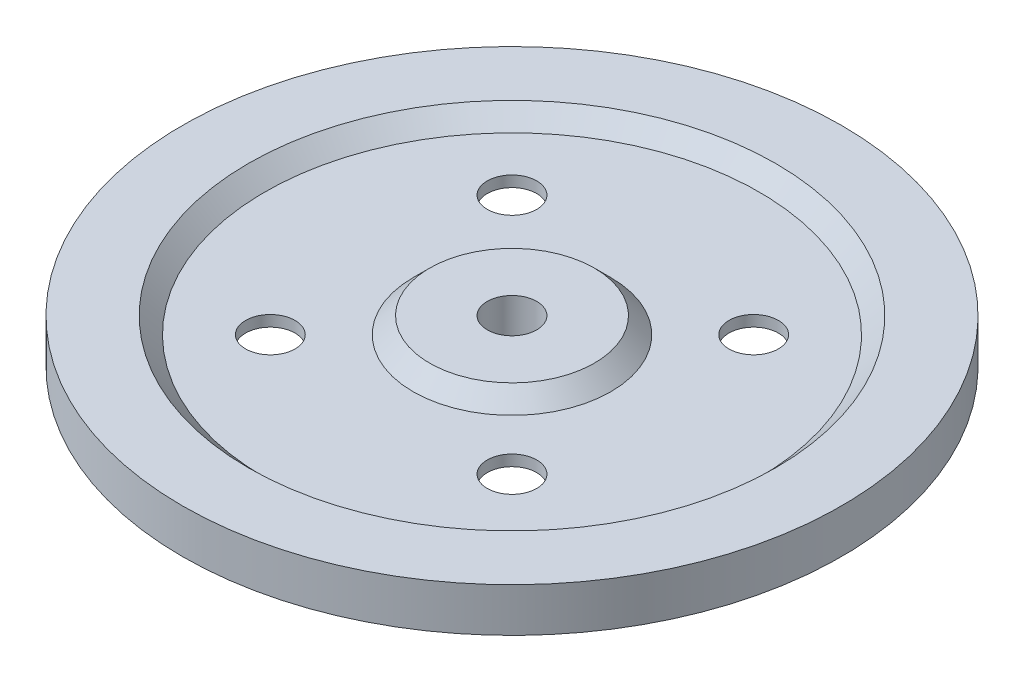
from build123d import *

# Parameters (mm, degrees)
SKETCH1_R               = 300
SKETCH1_R_2             = 225
BOSS_EXTRUDE1_DEPTH     = 20
SKETCH1_R_3             = 90
BOSS_EXTRUDE1_2_DEPTH   = 20
SKETCH3_R               = 225
BOSS_EXTRUDE3_DEPTH     = 5
CHAMFER2_SIZE           = 15
CUT_EXTRUDE1_DEPTH      = 425.735211632
CUT_EXTRUDE1_DEPTH_BACK = 425.735211632
SKETCH4_R               = 22.5


with BuildPart() as part:
    # Sketch1 → Boss-Extrude1 (new, symmetric)
    with BuildSketch(Plane(origin=(0, 0, 0), x_dir=(1, 0, 0), z_dir=(0, 1, 0))):
        with Locations(Location((0, 0, 0), (0, 0, 270))):
            Circle(SKETCH1_R)
        with Locations(Location((0, 0, 0), (0, 0, 270))):
            Circle(SKETCH1_R_2, mode=Mode.SUBTRACT)
    extrude(amount=BOSS_EXTRUDE1_DEPTH, both=True)



with BuildPart() as body_2:
    # Sketch1 → Boss-Extrude1 2 (new, symmetric)
    with BuildSketch(Plane(origin=(0, 0, 0), x_dir=(1, 0, 0), z_dir=(0, 1, 0))):
        with Locations(Location((0, 0, 0), (0, 0, 270))):
            Circle(SKETCH1_R_3)
    extrude(amount=BOSS_EXTRUDE1_2_DEPTH, both=True)


with BuildPart() as part_1:
    add(part.part)

    add(body_2.part)  # Boss-Extrude3 merges body 2
    # Sketch3 → Boss-Extrude3 (add, symmetric)
    with BuildSketch(Plane(origin=(0, 0, 0), x_dir=(1, 0, 0), z_dir=(0, 1, 0))):
        with Locations(Location((0, 0, 0), (0, 0, 270))):
            Circle(SKETCH3_R)
    extrude(amount=BOSS_EXTRUDE3_DEPTH, both=True)

    # Chamfer2
    chamfer2_edges = [part_1.edges().sort_by_distance(p)[0] for p in [
        (0, -20, -90),
        (0, 20, -90),
        (0, -20, -225),
        (0, 20, -225),
    ]]
    chamfer(chamfer2_edges, length=CHAMFER2_SIZE - 0.0001)  # a hair under: the kernel refuses the full size

    # Sketch4 → Cut-Extrude1 (cut, two sides: drawn at the far end of the back side and taken through both)
    with BuildSketch(Plane(origin=(0, 0, 0), x_dir=(1, 0, 0), z_dir=(0, 1, 0)).offset(-CUT_EXTRUDE1_DEPTH_BACK)):
        with Locations(Location((0, 0, 0), (0, 0, 270))):
            Circle(SKETCH4_R)
        with Locations(Location((-110, 110, 0), (0, 0, 270))):
            Circle(SKETCH4_R)
        with Locations(Location((110, 110, 0), (0, 0, 270))):
            Circle(SKETCH4_R)
        with Locations(Location((110, -110, 0), (0, 0, 270))):
            Circle(SKETCH4_R)
        with Locations(Location((-110, -110, 0), (0, 0, 270))):
            Circle(SKETCH4_R)
    extrude(amount=CUT_EXTRUDE1_DEPTH + CUT_EXTRUDE1_DEPTH_BACK, mode=Mode.SUBTRACT)


solid = part_1.part
